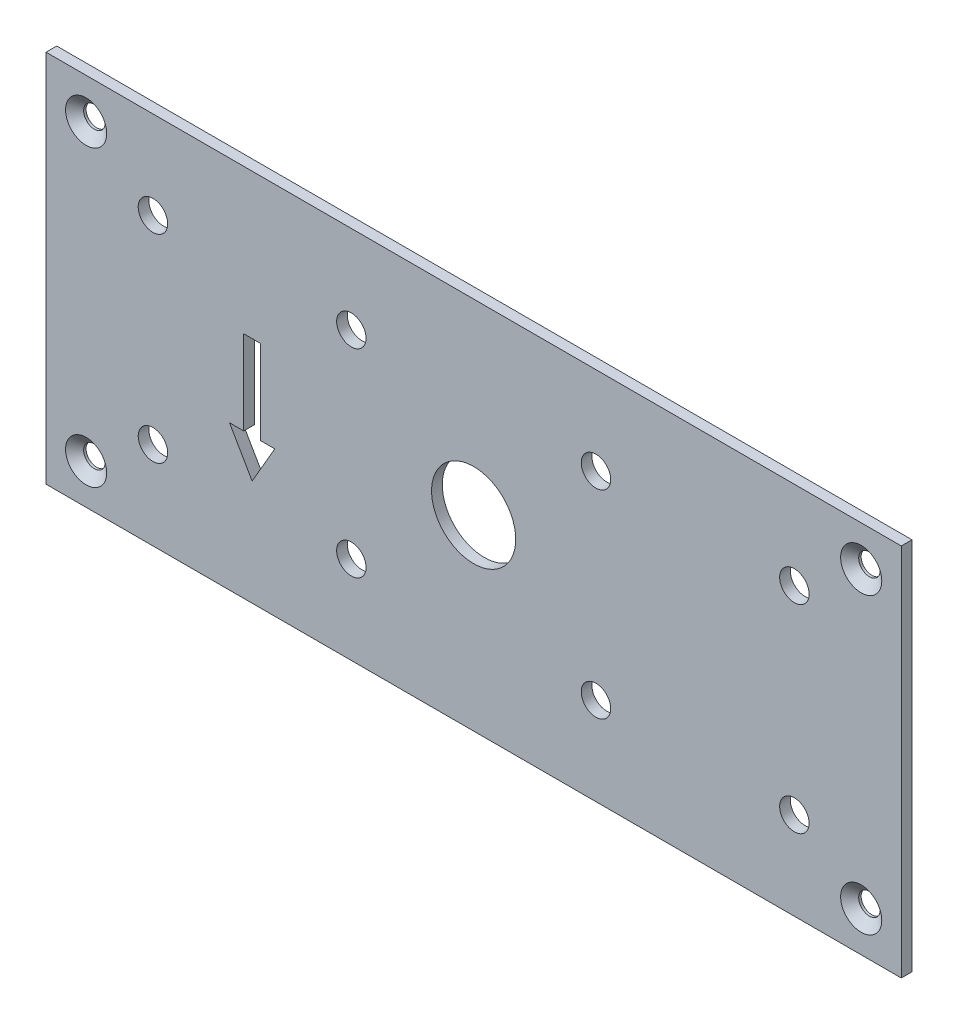
from build123d import *

# Parameters (mm, degrees)
SKETCH2_W                                  = 203.2
SKETCH2_H                                  = 88.9
SKETCH2_R                                  = 3.5
SKETCH2_R_2                                = 10
BOSS_EXTRUDE1_DEPTH                        = 1.27
SKETCH3_R                                  = 2.5527
CUT_EXTRUDE1_DEPTH                         = 111.92706658
CUT_EXTRUDE2_DEPTH                         = 111.92706658
CUT_EXTRUDE2_DEPTH_BACK                    = 111.92706658
CSK_FOR_10_FLAT_HEAD_MACHINE_SCREW_2_COUNT = 2
CSK_FOR_10_FLAT_HEAD_MACHINE_SCREW_2_PITCH = 69.85
CSK_FOR_10_FLAT_HEAD_MACHINE_SCREW_3_COUNT = 2
CSK_FOR_10_FLAT_HEAD_MACHINE_SCREW_3_PITCH = 196.952392725
CSK_FOR_10_FLAT_HEAD_MACHINE_SCREW_4_COUNT = 2
CSK_FOR_10_FLAT_HEAD_MACHINE_SCREW_4_PITCH = 184.15


with BuildPart() as part:
    # Sketch2 → Boss-Extrude1 (new, symmetric)
    with BuildSketch(Plane.XY):
        Rectangle(SKETCH2_W, SKETCH2_H)
        with Locations((-76.2, 23.57)):
            Circle(SKETCH2_R, mode=Mode.SUBTRACT)
        with Locations((-29.06, 23.57)):
            Circle(SKETCH2_R, mode=Mode.SUBTRACT)
        with Locations((-29.06, -23.57)):
            Circle(SKETCH2_R, mode=Mode.SUBTRACT)
        with Locations((-76.2, -23.57)):
            Circle(SKETCH2_R, mode=Mode.SUBTRACT)
        with Locations((29.06, -23.57)):
            Circle(SKETCH2_R, mode=Mode.SUBTRACT)
        with Locations((76.2, -23.57)):
            Circle(SKETCH2_R, mode=Mode.SUBTRACT)
        with Locations((76.2, 23.57)):
            Circle(SKETCH2_R, mode=Mode.SUBTRACT)
        with Locations((29.06, 23.57)):
            Circle(SKETCH2_R, mode=Mode.SUBTRACT)
        Circle(SKETCH2_R_2, mode=Mode.SUBTRACT)
    extrude(amount=BOSS_EXTRUDE1_DEPTH, both=True)

    # Sketch3 → Cut-Extrude1 (cut, through all)
    with BuildSketch(Plane.XY.offset(1.27)):
        with Locations((-92.075, 34.925)):
            Circle(SKETCH3_R)
        with Locations((-92.075, -34.925)):
            Circle(SKETCH3_R)
        with Locations((92.075, -34.925)):
            Circle(SKETCH3_R)
        with Locations((92.075, 34.925)):
            Circle(SKETCH3_R)
    extrude(amount=-CUT_EXTRUDE1_DEPTH, mode=Mode.SUBTRACT)

    # Sketch4 → Cut-Extrude2 (cut, two sides: drawn at the far end of the back side and taken through both)
    with BuildSketch(Plane.XY.offset(1.27).offset(-CUT_EXTRUDE2_DEPTH_BACK)):
        Polygon((-47.251206088, -10), (-50.63, -10), (-50.63, 10), (-54.63, 10), (-54.63, -10), (-58.008793912, -10), (-52.63, -19.316344338), align=None)
    extrude(amount=CUT_EXTRUDE2_DEPTH + CUT_EXTRUDE2_DEPTH_BACK, mode=Mode.SUBTRACT)

    # Sketch6 → CSK for #10 Flat Head Machine Screw (100)1 (revolve, cut)
    with BuildSketch(Plane(origin=(-92.075, 34.925, 1.27), x_dir=(0, -1, 0), z_dir=(1, 0, 0))):
        Polygon((0, 0), (0, 2.54), (2.5527, 2.54), (2.5527, 1.960808018), (4.8895, 0), align=None)
    csk_for_10_flat_head_machine_screw_100 = revolve(axis=Axis((-92.075, 34.925, 7.62), (0, 0, -1)), mode=Mode.SUBTRACT)

    # CSK for _10 Flat Head Machine Screw  2: CSK for #10 Flat Head Machine Screw (100)1 ×2
    with Locations(*[(0, -i * CSK_FOR_10_FLAT_HEAD_MACHINE_SCREW_2_PITCH, 0) for i in range(1, CSK_FOR_10_FLAT_HEAD_MACHINE_SCREW_2_COUNT)]):
        add(csk_for_10_flat_head_machine_screw_100, mode=Mode.SUBTRACT)

    # CSK for _10 Flat Head Machine Screw  3: CSK for #10 Flat Head Machine Screw (100)1 ×2
    with Locations(*[Vector(0.9349975263177835, -0.35465423412053854, 0) * (i * CSK_FOR_10_FLAT_HEAD_MACHINE_SCREW_3_PITCH) for i in range(1, CSK_FOR_10_FLAT_HEAD_MACHINE_SCREW_3_COUNT)]):
        add(csk_for_10_flat_head_machine_screw_100, mode=Mode.SUBTRACT)

    # CSK for _10 Flat Head Machine Screw  4: CSK for #10 Flat Head Machine Screw (100)1 ×2
    with Locations(*[(i * CSK_FOR_10_FLAT_HEAD_MACHINE_SCREW_4_PITCH, 0, 0) for i in range(1, CSK_FOR_10_FLAT_HEAD_MACHINE_SCREW_4_COUNT)]):
        add(csk_for_10_flat_head_machine_screw_100, mode=Mode.SUBTRACT)


solid = part.part
